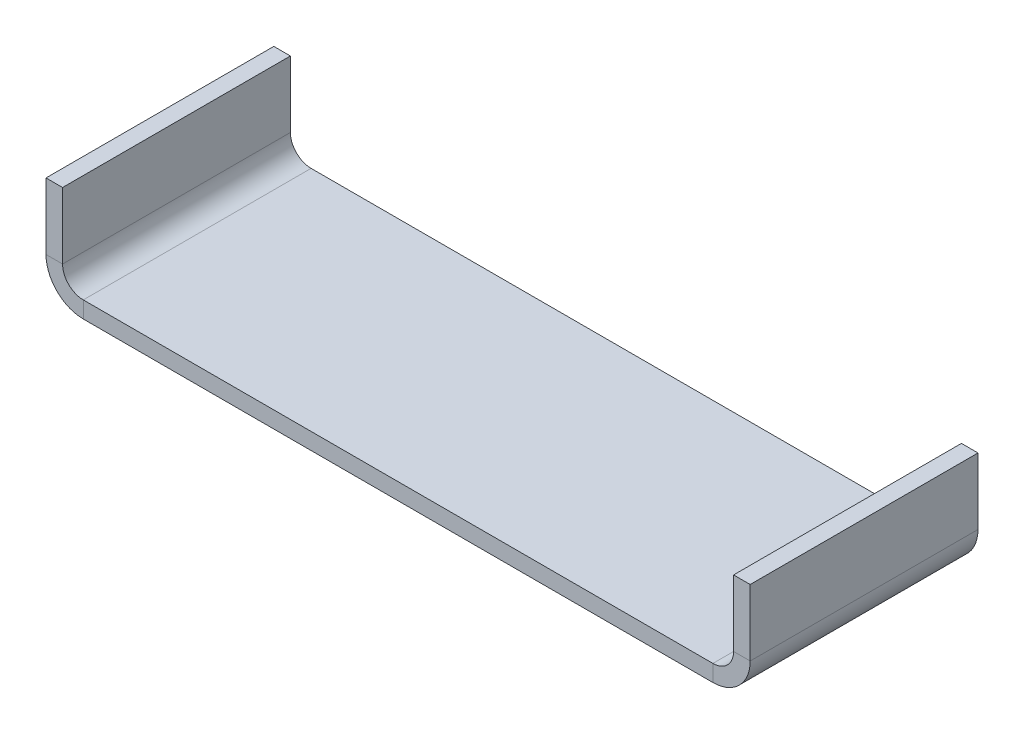
from build123d import *

# Parameters (mm, degrees)
SKETCH2_W                    = 170
SKETCH2_H                    = 110
BASE_FLANGE1_DEPTH           = 8
EDGE_FLANGE1_STRIP_W         = 52
EDGE_FLANGE1_STRIP_H         = 8
EDGE_FLANGE1_STRIP_CUT_DEPTH = 110
EDGE_FLANGE1_DEPTH           = 110


# Sheet-metal steps are written as plain solids
with BuildPart() as part:
    # Sketch2 → Base-Flange1 (new body)
    with BuildSketch(Plane(origin=(0, 0, 0), x_dir=(1, 0, 0), z_dir=(0, 1, 0))):
        Rectangle(SKETCH2_W, SKETCH2_H)
    extrude(amount=-BASE_FLANGE1_DEPTH)

    # Edge-Flange1 strip (across the edge) → Edge-Flange1 strip cut (cut)
    with BuildSketch(Plane(origin=(85, 0, 55), x_dir=(-1, 0, 0), z_dir=(0, 0, -1))):
        with Locations((-8, -4)):
            Rectangle(EDGE_FLANGE1_STRIP_W, EDGE_FLANGE1_STRIP_H)
    extrude(amount=EDGE_FLANGE1_STRIP_CUT_DEPTH, mode=Mode.SUBTRACT)

    # Edge-Flange1 section (across the edge) → Edge-Flange1 (add)
    with BuildSketch(Plane(origin=(85, 0, 55), x_dir=(-1, 0, 0), z_dir=(0, 0, -1))):
        with BuildLine():
            Line((0, 10), (0, 42))
            Line((0, 42), (8, 42))
            Line((8, 42), (8, 10))
            ThreePointArc((8, 10), (10.928932188, 2.928932188), (18, 0))
            Line((18, 0), (18, -8))
            ThreePointArc((18, -8), (5.272077939, -2.727922061), (0, 10))
        make_face()
    extrude(amount=EDGE_FLANGE1_DEPTH)

    # Mirror1: part across plane


with BuildPart() as part_1:
    add(part.part)
    add(part.part.mirror(Plane(origin=(-85, -8, 55), x_dir=(0, 0, 1), z_dir=(-1, 0, 0))))


solid = part_1.part
